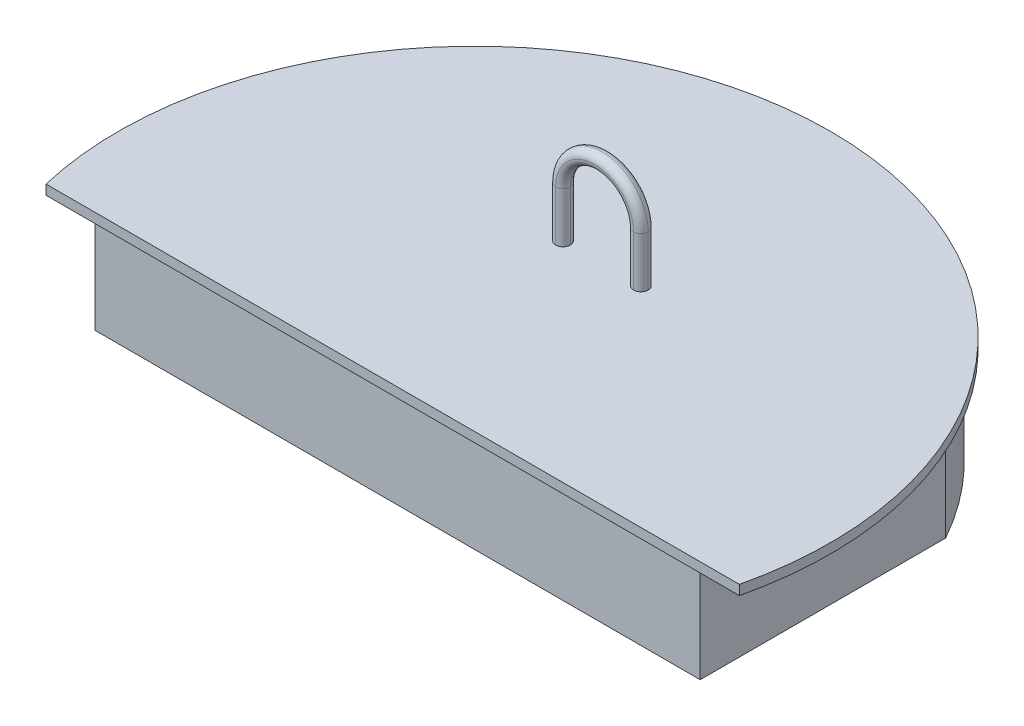
from build123d import *

# Parameters (mm, degrees)
BOSS_EXTRUDE1_DEPTH      = 20
BOSS_EXTRUDE1_2_DEPTH    = 20
SKETCH2_R                = 73.2
BOSS_EXTRUDE2_DEPTH      = 2
BODY_DELETE_KEEP_1_DEPTH = 22
BOSS_EXTRUDE3_DEPTH      = 1.5
BOSS_EXTRUDE3_DEPTH_BACK = 1.5
FILLET1_R                = 1.5


# Read off the part's stored shape, not the designer's step: Body-Delete/Keep 1
with BuildPart() as part:
    # Sketch1 → Boss-Extrude1 (new body)
    with BuildSketch(Plane(origin=(0, 0, 0), x_dir=(1, 0, 0), z_dir=(0, 1, 0))):
        with BuildLine():
            Line((62.2, -17.8), (-62.2, -17.8))
            Line((-62.2, -17.8), (-62.2, -34.649675323))
            ThreePointArc((-62.2, -34.649675323), (0, -71.2), (62.2, -34.649675323))
            Line((62.2, -34.649675323), (62.2, -17.8))
        make_face()
        with BuildLine():
            Line((60.2, -34.126236241), (60.2, -19.8))
            Line((60.2, -19.8), (-60.2, -19.8))
            Line((-60.2, -19.8), (-60.2, -34.126236241))
            ThreePointArc((-60.2, -34.126236241), (0, -69.2), (60.2, -34.126236241))
        make_face(mode=Mode.SUBTRACT)
    extrude(amount=BOSS_EXTRUDE1_DEPTH)


with BuildPart() as body_2:
    # Sketch1 → Boss-Extrude1 2 (new body)
    with BuildSketch(Plane(origin=(0, 0, 0), x_dir=(1, 0, 0), z_dir=(0, 1, 0))):
        with BuildLine():
            Line((-62.2, -15.8), (62.2, -15.8))
            Line((62.2, -15.8), (62.2, 34.649675323))
            ThreePointArc((62.2, 34.649675323), (0, 71.2), (-62.2, 34.649675323))
            Line((-62.2, 34.649675323), (-62.2, -15.8))
        make_face()
        with BuildLine():
            Line((-60.2, 34.126236241), (-60.2, -13.8))
            Line((-60.2, -13.8), (60.2, -13.8))
            Line((60.2, -13.8), (60.2, 34.126236241))
            ThreePointArc((60.2, 34.126236241), (0, 69.2), (-60.2, 34.126236241))
        make_face(mode=Mode.SUBTRACT)
    extrude(amount=BOSS_EXTRUDE1_2_DEPTH)


with BuildPart() as body_3:
    # Sketch2 → Boss-Extrude2 (new body)
    with BuildSketch(Plane(origin=(0, 20, 0), x_dir=(1, 0, 0), z_dir=(0, 1, 0))):
        with Locations(Location((0, 0, 0), (0, 0, 270))):
            Circle(SKETCH2_R)
    extrude(amount=BOSS_EXTRUDE2_DEPTH)


with BuildPart() as body_4:
    # Split1: the piece on the far side of the plane
    add(body_3.part)
    split(bisect_by=Plane.XY.offset(16.8), keep=Keep.BOTTOM)

    # Sketch3 → Boss-Extrude3 (add, two sides: drawn at the far end of the back side and taken through both)
    with BuildSketch(Plane(origin=(0, 0, -26.2), x_dir=(-1, 0, 0), z_dir=(0, 0, -1)).offset(-BOSS_EXTRUDE3_DEPTH_BACK)):
        with BuildLine():
            Line((9.5, 9.641102956), (9.5, 32.358897044))
            ThreePointArc((9.5, 32.358897044), (0, 41.858897044), (-9.5, 32.358897044))
            Line((-9.5, 32.358897044), (-9.5, 9.641102956))
            ThreePointArc((-9.5, 9.641102956), (0, 0.141102956), (9.5, 9.641102956))
        make_face()
        with BuildLine():
            ThreePointArc((6.5, 32.358897044), (0, 38.858897044), (-6.5, 32.358897044))
            Line((-6.5, 32.358897044), (-6.5, 9.641102956))
            ThreePointArc((-6.5, 9.641102956), (0, 3.141102956), (6.5, 9.641102956))
            Line((6.5, 9.641102956), (6.5, 32.358897044))
        make_face(mode=Mode.SUBTRACT)
    extrude(amount=BOSS_EXTRUDE3_DEPTH + BOSS_EXTRUDE3_DEPTH_BACK)

    # Fillet1
    fillet1_edges = [body_4.edges().sort_by_distance(p)[0] for p in [
        (6.5, 14.820551478, -27.7),
        (-9.5, 14.820551478, -27.7),
        (-6.5, 14.820551478, -27.7),
        (0, 3.141102956, -27.7),
        (0, 0.141102956, -27.7),
        (9.5, 14.820551478, -27.7),
        (6.5, 14.820551478, -24.7),
        (0, 3.141102956, -24.7),
        (-6.5, 14.820551478, -24.7),
        (-9.5, 14.820551478, -24.7),
        (0, 0.141102956, -24.7),
        (9.5, 14.820551478, -24.7),
        (9.5, 27.179448522, -24.7),
        (0, 41.858897044, -24.7),
        (-9.5, 27.179448522, -24.7),
        (-9.5, 27.179448522, -27.7),
        (9.5, 27.179448522, -27.7),
        (0, 41.858897044, -27.7),
        (6.5, 27.179448522, -27.7),
        (0, 38.858897044, -27.7),
        (-6.5, 27.179448522, -27.7),
        (-6.5, 27.179448522, -24.7),
        (6.5, 27.179448522, -24.7),
        (0, 38.858897044, -24.7),
    ]]
    fillet(fillet1_edges, radius=FILLET1_R - 0.0001)  # a hair under: the kernel refuses the full size


with BuildPart() as body_3_1:
    add(body_3.part)

    # Split1
    split(bisect_by=Plane.XY.offset(16.8), keep=Keep.TOP)


with BuildPart() as body_delete_keep_1_tool:
    # Body-Delete/Keep 1 outline → Body-Delete/Keep 1 (new body)
    with BuildSketch(Plane(origin=(0, 0, 0), x_dir=(1, 0, 0), z_dir=(0, 1, 0))):
        with BuildLine():
            ThreePointArc((-71.246052522, -16.8), (0, -73.2), (71.246052522, -16.8))
            Line((71.246052522, -16.8), (-71.246052522, -16.8))
        make_face()
    extrude(amount=BODY_DELETE_KEEP_1_DEPTH)


with BuildPart() as part_1:
    add(part.part)

    # Body-Delete/Keep 1: cut by body_delete_keep_1_tool
    add(body_delete_keep_1_tool.part, mode=Mode.SUBTRACT)


with BuildPart() as body_3_2:
    add(body_3_1.part)

    # Body-Delete/Keep 1: cut by body_delete_keep_1_tool
    add(body_delete_keep_1_tool.part, mode=Mode.SUBTRACT)


solid = Compound([body_2.part, body_4.part])
